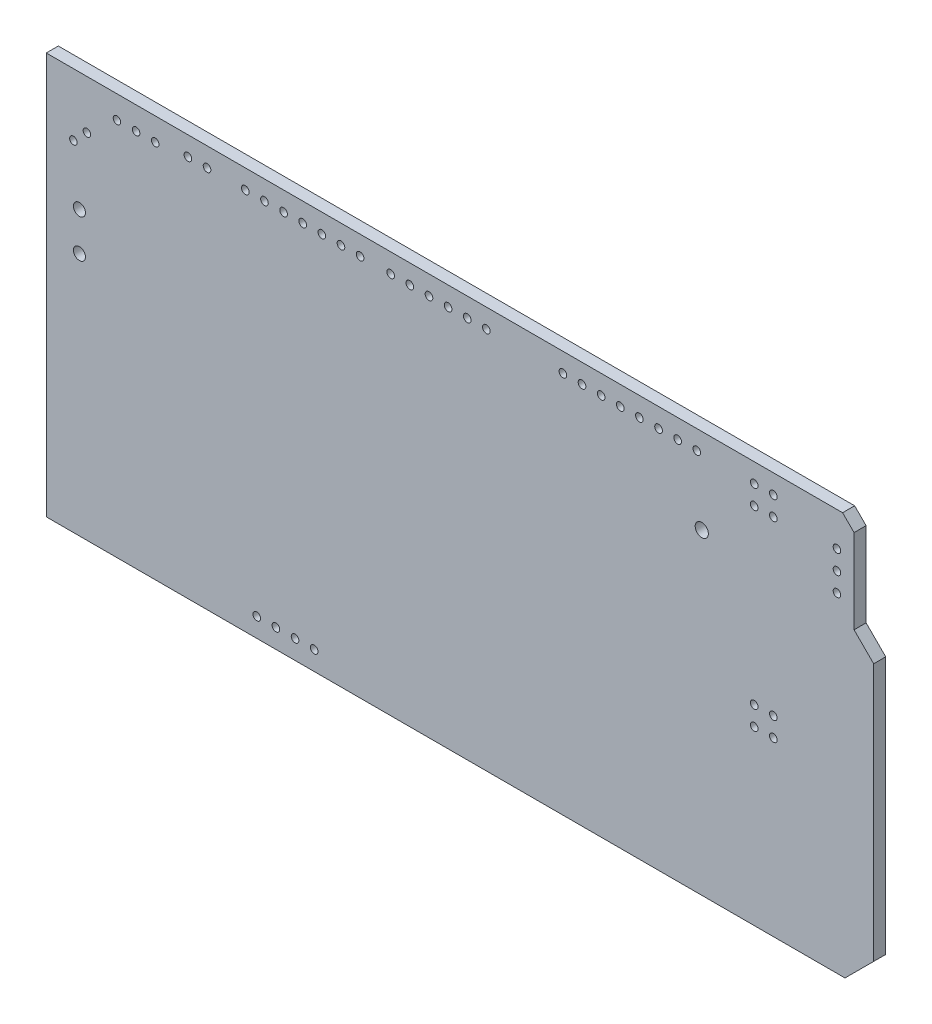
from build123d import *

# Parameters (mm, degrees)
BOARD_DEPTH        = 1.6
SKETCH2_R          = 0.8765
SKETCH2_R_2        = 0.8
SKETCH2_R_3        = 0.5
SKETCH2_R_4        = 0.508
CUT_EXTRUDE3_DEPTH = 262.833261375


with BuildPart() as part:
    # Sketch1 → BOARD (new body)
    with BuildSketch(Plane.XY):
        Polygon((110.1725, -141.9225), (216.2175, -141.9225), (220.0275, -138.1125), (220.0275, -103.886), (217.424, -101.2825), (217.424, -90.17), (217.424, -90.1065), (215.9, -88.5825), (110.1725, -88.5825), align=None)
    extrude(amount=BOARD_DEPTH)

    # Sketch2 → Cut-Extrude3 (cut, through all)
    with BuildSketch(Plane.XY):
        with Locations((197.2044, -99.9152)):
            Circle(SKETCH2_R)
        with Locations((114.575, -109.45)):
            Circle(SKETCH2_R_2)
        with Locations((114.575, -104.37)):
            Circle(SKETCH2_R_2)
        with Locations((124.64, -91.62)):
            Circle(SKETCH2_R_3)
        with Locations((122.1, -91.62)):
            Circle(SKETCH2_R_3)
        with Locations((119.56, -91.62)):
            Circle(SKETCH2_R_3)
        with Locations((115.57, -95.0468)):
            Circle(SKETCH2_R_3)
        with Locations((113.77395, -96.84285)):
            Circle(SKETCH2_R_3)
        with Locations((215.15, -98.19)):
            Circle(SKETCH2_R_3)
        with Locations((215.15, -95.65)):
            Circle(SKETCH2_R_3)
        with Locations((215.15, -93.11)):
            Circle(SKETCH2_R_3)
        with Locations((145.743, -139.385)):
            Circle(SKETCH2_R_4)
        with Locations((143.203, -139.385)):
            Circle(SKETCH2_R_4)
        with Locations((140.663, -139.385)):
            Circle(SKETCH2_R_4)
        with Locations((196.543, -91.125)):
            Circle(SKETCH2_R_4)
        with Locations((194.003, -91.125)):
            Circle(SKETCH2_R_4)
        with Locations((191.463, -91.125)):
            Circle(SKETCH2_R_4)
        with Locations((188.923, -91.125)):
            Circle(SKETCH2_R_4)
        with Locations((186.383, -91.125)):
            Circle(SKETCH2_R_4)
        with Locations((183.843, -91.125)):
            Circle(SKETCH2_R_4)
        with Locations((181.303, -91.125)):
            Circle(SKETCH2_R_4)
        with Locations((178.763, -91.125)):
            Circle(SKETCH2_R_4)
        with Locations((168.603, -91.125)):
            Circle(SKETCH2_R_4)
        with Locations((166.063, -91.125)):
            Circle(SKETCH2_R_4)
        with Locations((163.523, -91.125)):
            Circle(SKETCH2_R_4)
        with Locations((160.983, -91.125)):
            Circle(SKETCH2_R_4)
        with Locations((158.443, -91.125)):
            Circle(SKETCH2_R_4)
        with Locations((155.903, -91.125)):
            Circle(SKETCH2_R_4)
        with Locations((136.599, -91.125)):
            Circle(SKETCH2_R_4)
        with Locations((151.839, -91.125)):
            Circle(SKETCH2_R_4)
        with Locations((149.299, -91.125)):
            Circle(SKETCH2_R_4)
        with Locations((146.759, -91.125)):
            Circle(SKETCH2_R_4)
        with Locations((128.979, -91.125)):
            Circle(SKETCH2_R_4)
        with Locations((131.519, -91.125)):
            Circle(SKETCH2_R_4)
        with Locations((139.139, -91.125)):
            Circle(SKETCH2_R_4)
        with Locations((141.679, -91.125)):
            Circle(SKETCH2_R_4)
        with Locations((144.219, -91.125)):
            Circle(SKETCH2_R_4)
        with Locations((138.123, -139.385)):
            Circle(SKETCH2_R_4)
        with Locations((204.163, -91.125)):
            Circle(SKETCH2_R_4)
        with Locations((206.703, -91.125)):
            Circle(SKETCH2_R_4)
        with Locations((204.163, -93.665)):
            Circle(SKETCH2_R_4)
        with Locations((206.703, -93.665)):
            Circle(SKETCH2_R_4)
        with Locations((204.163, -116.525)):
            Circle(SKETCH2_R_4)
        with Locations((206.703, -116.525)):
            Circle(SKETCH2_R_4)
        with Locations((204.163, -119.065)):
            Circle(SKETCH2_R_4)
        with Locations((206.703, -119.065)):
            Circle(SKETCH2_R_4)
    extrude(amount=CUT_EXTRUDE3_DEPTH, mode=Mode.SUBTRACT)


solid = part.part
